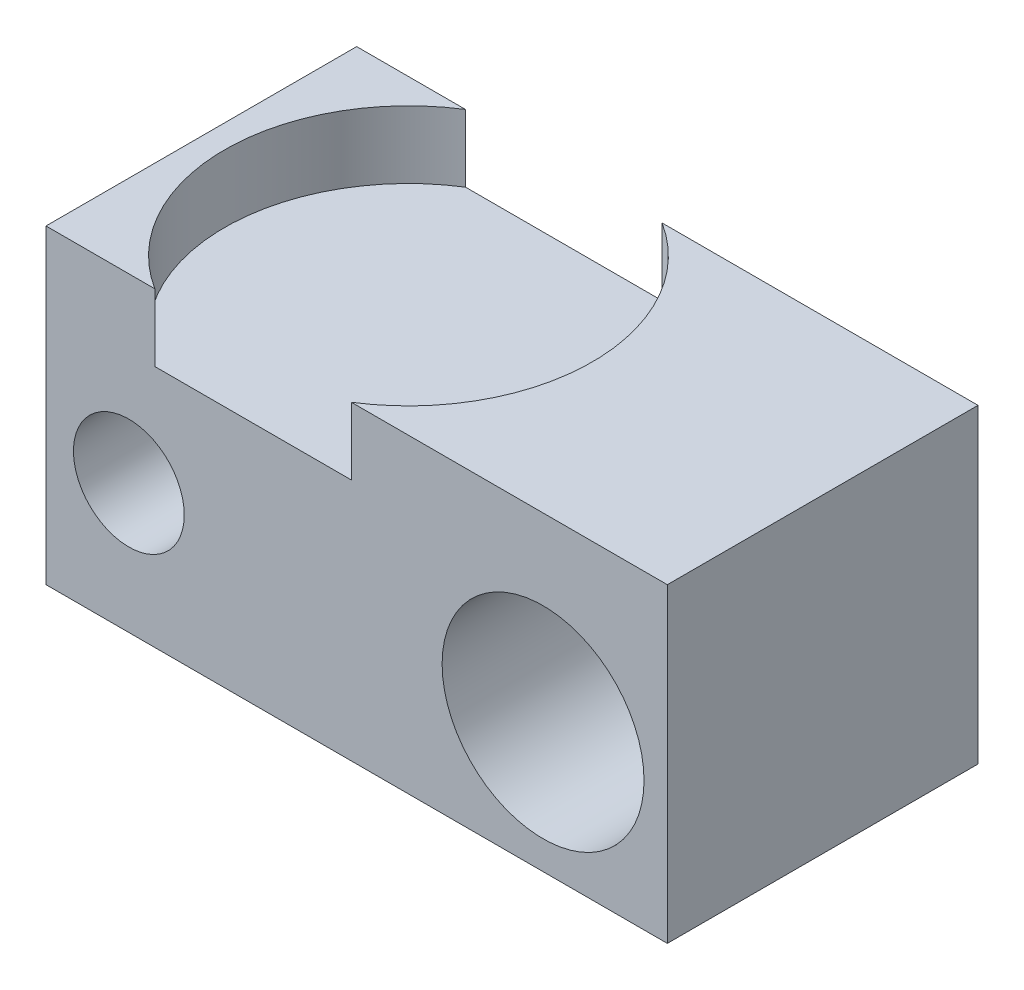
from build123d import *
from build123d.topology import SkipClean

# Parameters (mm, degrees)
SKETCH1_W           = 60
SKETCH1_H           = 25
SKETCH1_R           = 9.75
SKETCH1_R_2         = 5.35
BOSS_EXTRUDE1_DEPTH = 30
BOSS_EXTRUDE2_DEPTH = 5
CUT_EXTRUDE1_START  = -1.5
SKETCH2_3_R         = 17.75
CUT_EXTRUDE1_DEPTH  = 1.5


with BuildPart() as part:
    # Sketch1 → Boss-Extrude1 (new body)
    with BuildSketch(Plane.XY):
        Rectangle(SKETCH1_W, SKETCH1_H)
        with Locations((18, 0)):
            Circle(SKETCH1_R, mode=Mode.SUBTRACT)
        with Locations((-22, 0)):
            Circle(SKETCH1_R_2, mode=Mode.SUBTRACT)
    extrude(amount=BOSS_EXTRUDE1_DEPTH)

    # Sketch2 → Boss-Extrude2 (add)
    with BuildSketch(Plane(origin=(0, 12.5, 0), x_dir=(1, 0, 0), z_dir=(0, 1, 0))):
        with BuildLine():
            ThreePointArc((-0.509873552, 0), (7.75, -15), (-0.509873552, -30))
            Line((-0.509873552, -30), (30, -30))
            Line((30, -30), (30, 0))
            Line((30, 0), (-0.509873552, 0))
        make_face()
        with BuildLine():
            ThreePointArc((-19.490126448, -30), (-27.75, -15), (-19.490126448, 0))
            Line((-19.490126448, 0), (-30, 0))
            Line((-30, 0), (-30, -30))
            Line((-30, -30), (-19.490126448, -30))
        make_face()
    extrude(amount=BOSS_EXTRUDE2_DEPTH)

    # Sketch2<3> → Cut-Extrude1 (cut)
    with SkipClean():  # the faces are left unmerged after this step: merging them gives an invalid solid
        with BuildSketch(Plane(origin=(0, 12.5, 0), x_dir=(1, 0, 0), z_dir=(0, 1, 0)).offset(CUT_EXTRUDE1_START)):
            with Locations((-10, -15)):
                Circle(SKETCH2_3_R)
        extrude(amount=CUT_EXTRUDE1_DEPTH, mode=Mode.SUBTRACT)


solid = part.part
